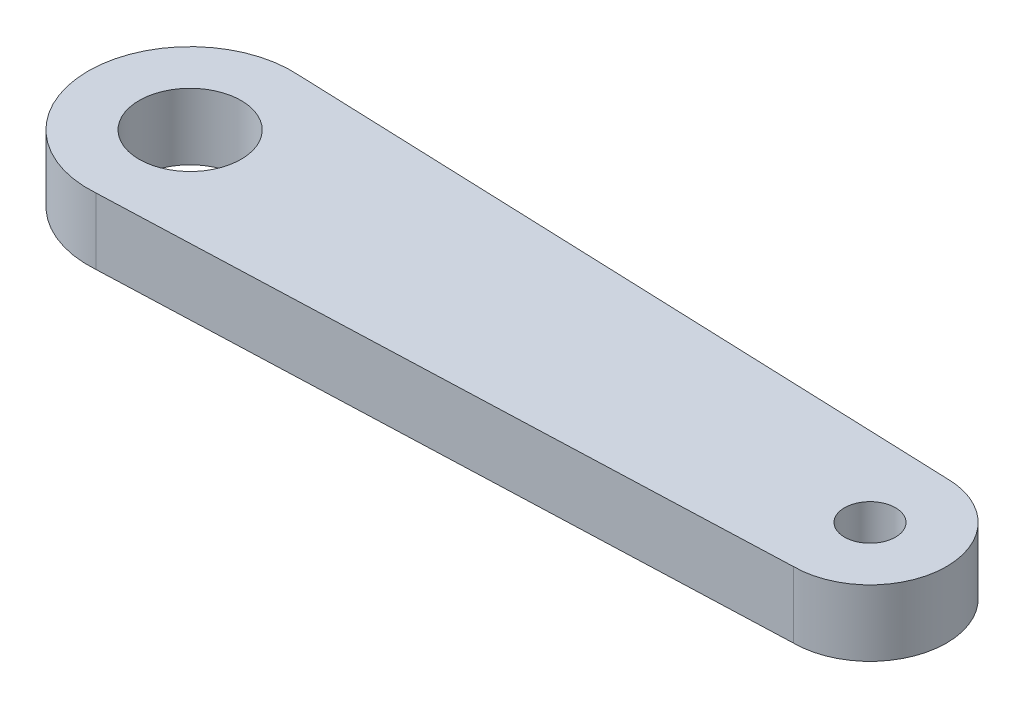
from build123d import *

# Parameters (mm, degrees)
BOSS_EXTRUDE1_DEPTH     = 3.9
CUT_EXTRUDE1_DEPTH      = 16
CUT_EXTRUDE1_DEPTH_BACK = 10.5
SKETCH2_R               = 3
SKETCH2_R_2             = 1.5


with BuildPart() as part:
    # Sketch1 → Boss-Extrude1 (new body)
    with BuildSketch(Plane(origin=(0, 0, 0), x_dir=(1, 0, 0), z_dir=(0, 1, 0))):
        with BuildLine():
            Line((0.449368076, 5.983148697), (40, 4.5))
            ThreePointArc((40, 4.5), (44.5, 0), (40, -4.5))
            Line((40, -4.5), (0.449368076, -5.983148697))
            ThreePointArc((0.449368076, -5.983148697), (-6, 0), (0.449368076, 5.983148697))
        make_face()
    extrude(amount=BOSS_EXTRUDE1_DEPTH)

    # Sketch2 → Cut-Extrude1 (cut, two sides: drawn at the far end of the back side and taken through both)
    with BuildSketch(Plane(origin=(0, 3.9, 0), x_dir=(1, 0, 0), z_dir=(0, 1, 0)).offset(-CUT_EXTRUDE1_DEPTH_BACK)):
        Circle(SKETCH2_R)
        with Locations((40, 0)):
            Circle(SKETCH2_R_2)
    extrude(amount=CUT_EXTRUDE1_DEPTH + CUT_EXTRUDE1_DEPTH_BACK, mode=Mode.SUBTRACT)


solid = part.part
